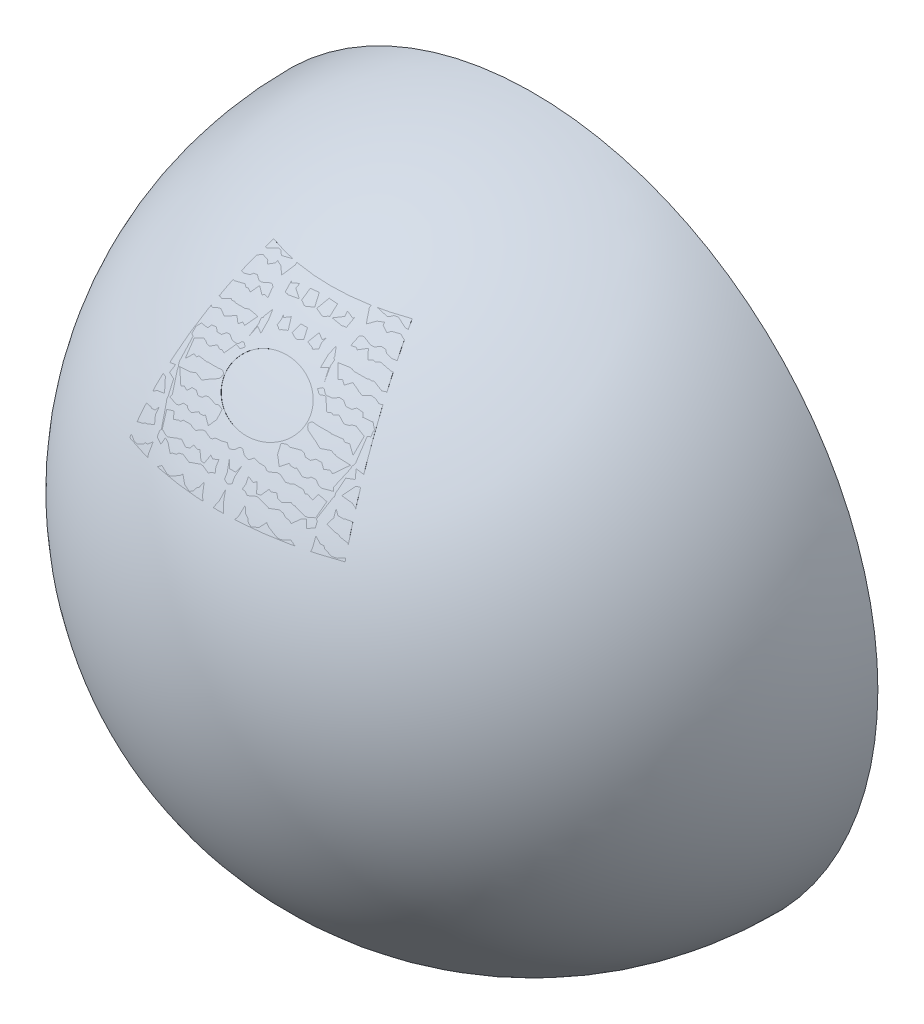
from build123d import *

# Parameters (mm, degrees)
REVOLVE_2_ANGLE           = 180
REVOLVE_3_ANGLE           = 20
REVOLVE_3_OTHER_WAY_ANGLE = 20
SWEEP_START               = 94.23905762
SWEEP_1_DEPTH             = 5.76094238


# Read off the part's stored shape, not the designer's step: Вырез-По траектории1
with BuildPart() as part:
    # Эскиз1 → Повернуть2 (revolve)
    with BuildSketch(Plane.XY):
        with BuildLine():
            Line((0, 100), (0, -100))
            ThreePointArc((0, -100), (100, 0), (0, 100))
        make_face()
    revolve(axis=Axis((0, 100, 0), (0, -1, 0)), revolution_arc=REVOLVE_2_ANGLE)


with BuildPart() as body_2:
    # Эскиз2 → Повернуть3 (revolve)
    with BuildSketch(Plane(origin=(0, 0, 0), x_dir=(0, 0, -1), z_dir=(1, 0, 0))):
        with BuildLine():
            Line((-91.359922709, 40.661585344), (-86.791926573, 38.628506077))
            ThreePointArc((-86.791926573, 38.628506077), (-73.836770334, 59.775675209), (-55.849760218, 76.849230859))
            Line((-55.849760218, 76.849230859), (-58.789221282, 80.89392722))
            ThreePointArc((-58.789221282, 80.89392722), (-77.722916141, 62.921763377), (-91.359922709, 40.661585344))
        make_face()
    revolve(axis=Axis((0, 0, 0), (0, 1, 0)), revolution_arc=REVOLVE_3_ANGLE)

    # Эскиз2 → Повернуть3 other way (revolve)
    with BuildSketch(Plane(origin=(0, 0, 0), x_dir=(0, 0, -1), z_dir=(1, 0, 0))):
        with BuildLine():
            Line((-91.359922709, 40.661585344), (-86.791926573, 38.628506077))
            ThreePointArc((-86.791926573, 38.628506077), (-73.836770334, 59.775675209), (-55.849760218, 76.849230859))
            Line((-55.849760218, 76.849230859), (-58.789221282, 80.89392722))
            ThreePointArc((-58.789221282, 80.89392722), (-77.722916141, 62.921763377), (-91.359922709, 40.661585344))
        make_face()
    revolve(axis=Axis((0, 0, 0), (0, -1, 0)), revolution_arc=REVOLVE_3_OTHER_WAY_ANGLE)

    # Вырез-По траектории1 outline → Вырез-По траектории1 (cut)
    with BuildSketch(Plane(origin=(0, 0, 0), x_dir=(1, 0, 0), z_dir=(0, 0.6292176337744182, 0.7772291614107913)).offset(SWEEP_START)):
        with BuildLine():
            add(Edge.make_bspline(
                [(12, 0), (12, 18.653499874), (-12, 18.653499874), (-12, 0), (-12, -18.653499874), (12, -18.653499874), (12, 0)],
                knots=[0, 0, 0, 0, 0.5, 0.5, 0.5, 1, 1, 1, 1], degree=3, weights=[1, 0.333333333, 0.333333333, 1, 0.333333333, 0.333333333, 1]))
        make_face()
    extrude(amount=SWEEP_1_DEPTH, mode=Mode.SUBTRACT)


solid = Compound([part.part, body_2.part])
